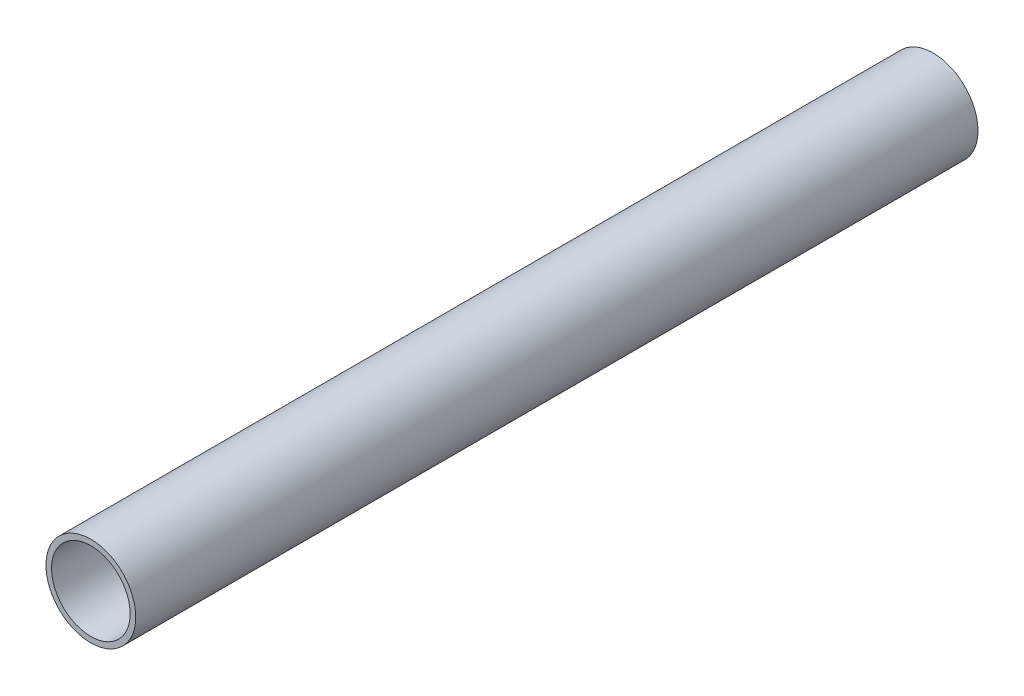
from build123d import *

# Parameters (mm, degrees)
SKETCH1_R           = 8
SKETCH1_R_2         = 7
BOSS_EXTRUDE1_DEPTH = 150


with BuildPart() as part:
    # Sketch1 → Boss-Extrude1 (new body)
    with BuildSketch(Plane.XY):
        Circle(SKETCH1_R)
        Circle(SKETCH1_R_2, mode=Mode.SUBTRACT)
    extrude(amount=BOSS_EXTRUDE1_DEPTH)


solid = part.part
